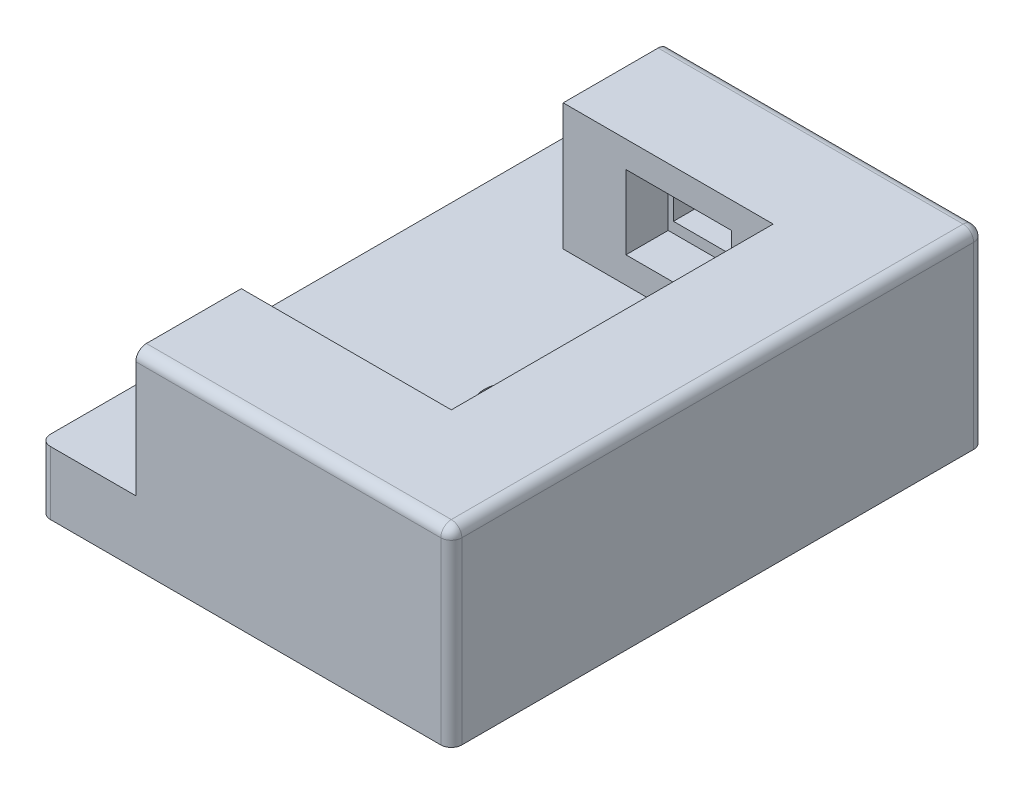
from build123d import *

# Parameters (mm, degrees)
SKETCH1_W           = 39
SKETCH1_H           = 50.5
BOSS_EXTRUDE1_DEPTH = 6
SKETCH2_W           = 19.9
SKETCH2_H           = 10
BOSS_EXTRUDE2_DEPTH = 12
FILLET1_R           = 1
SKETCH3_W           = 10
SKETCH3_H           = 7
CUT_EXTRUDE1_DEPTH  = 4
SKETCH4_W           = 9
SKETCH4_H           = 5
CUT_EXTRUDE2_DEPTH  = 30
SKETCH7_W           = 8.4
SKETCH7_H           = 42
CUT_EXTRUDE4_DEPTH  = 1
SKETCH6_R           = 2.625
CUT_EXTRUDE5_DEPTH  = 7
FILLET2_R           = 1
CUT_EXTRUDE6_START  = -0.2
CUT_EXTRUDE6_DEPTH  = 0.2


# Read off the part's stored shape, not the designer's step: Cut-Extrude6
with BuildPart() as part:
    # Sketch1 → Boss-Extrude1 (new body)
    with BuildSketch(Plane(origin=(0, 0, 0), x_dir=(1, 0, 0), z_dir=(0, 1, 0))):
        Rectangle(SKETCH1_W, SKETCH1_H)
    extrude(amount=BOSS_EXTRUDE1_DEPTH)

    # Sketch2 → Boss-Extrude2 (add)
    with BuildSketch(Plane(origin=(0, 6, 0), x_dir=(1, 0, 0), z_dir=(0, 1, 0))):
        with Locations((-0.45, 20.25)):
            Rectangle(SKETCH2_W, SKETCH2_H)
        Polygon((19.5, -25.25), (19.5, 25.25), (9.5, 25.25), (9.5, 15.25), (9.5, -15.25), (9.5, -25.25), align=None)
        with Locations((-0.45, -20.25)):
            Rectangle(SKETCH2_W, SKETCH2_H)
    extrude(amount=BOSS_EXTRUDE2_DEPTH)

    # Fillet1
    fillet1_edges = [part.edges().sort_by_distance(p)[0] for p in [
        (19.5, 9, 25.25),
        (-19.5, 3, 25.25),
        (-19.5, 3, -25.25),
        (19.5, 9, -25.25),
    ]]
    fillet(fillet1_edges, radius=FILLET1_R)

    # Sketch3 → Cut-Extrude1 (cut)
    with BuildSketch(Plane.XY.offset(-15.25)):
        with Locations((0.55, 12)):
            Rectangle(SKETCH3_W, SKETCH3_H)
    extrude(amount=-CUT_EXTRUDE1_DEPTH, mode=Mode.SUBTRACT)

    # Sketch4 → Cut-Extrude2 (cut)
    with BuildSketch(Plane.XY.offset(-19.25)):
        with Locations((0.55, 12)):
            Rectangle(SKETCH4_W, SKETCH4_H)
    extrude(amount=-CUT_EXTRUDE2_DEPTH, mode=Mode.SUBTRACT)

    # Sketch7 → Cut-Extrude4 (cut)
    with BuildSketch(Plane.XZ):
        Rectangle(SKETCH7_W, SKETCH7_H)
    extrude(amount=-CUT_EXTRUDE4_DEPTH, mode=Mode.SUBTRACT)

    # Sketch6 → Cut-Extrude5 (cut)
    with BuildSketch(Plane.XZ):
        with Locations(Location((0, 0, 0), (0, 0, 270))):
            Circle(SKETCH6_R)
    extrude(amount=-CUT_EXTRUDE5_DEPTH, mode=Mode.SUBTRACT)

    # Fillet2
    fillet2_edges = [part.edges().sort_by_distance(p)[0] for p in [
        (4.05, 18, 25.25),
        (4.05, 18, -25.25),
        (19.5, 18, 0),
        (19.207106781, 18, 24.957106781),
        (19.207106781, 18, -24.957106781),
    ]]
    fillet(fillet2_edges, radius=FILLET2_R)

    # Cut-Extrude6 outline → Cut-Extrude6 (cut)
    # profile 1 of 4: a face of its own
    with BuildSketch(Plane.XZ.offset(CUT_EXTRUDE6_START)):
        with BuildLine():
            add(Edge.make_bspline(
                [(-14.308131241, 13.125263447), (-14.308980223, 13.087665755), (-14.310639776, 13.014171423), (-14.322776413, 12.906989941), (-14.3431925, 12.805891458), (-14.372807449, 12.711212736), (-14.409568321, 12.622206203), (-14.455631717, 12.539891336), (-14.509298167, 12.463522469), (-14.571714418, 12.394314956), (-14.641685625, 12.331476542), (-14.720907067, 12.278367739), (-14.807094418, 12.23190008), (-14.901740923, 12.195472099), (-15.003772579, 12.165777911), (-15.113932246, 12.145562231), (-15.23201314, 12.133422526), (-15.31333151, 12.131803373), (-15.355206847, 12.130969581)],
                knots=[0, 0, 0, 0, 0.06856617, 0.134030168, 0.196454761, 0.256394301, 0.314703772, 0.371776203, 0.428085687, 0.484590203, 0.541418281, 0.599152462, 0.658128935, 0.719652317, 0.783746101, 0.851702059, 0.923633168, 1, 1, 1, 1], degree=3))
            Line((-14.308131241, 13.125263447), (-14.308131241, 14.716561592))
            add(Edge.make_bspline(
                [(-15.355206847, 15.710855458), (-15.313334474, 15.710012414), (-15.232021861, 15.708375294), (-15.113900457, 15.696362026), (-15.003946149, 15.675717663), (-14.901404463, 15.647543433), (-14.807491008, 15.609521297), (-14.720678738, 15.564382427), (-14.641729685, 15.510984245), (-14.571671344, 15.44826556), (-14.509555785, 15.379068609), (-14.455379108, 15.303295374), (-14.409812711, 15.221170885), (-14.372475701, 15.13240295), (-14.343358879, 15.037542429), (-14.322676053, 14.936043397), (-14.310661195, 14.828359853), (-14.3089874, 14.754395113), (-14.308131241, 14.716561592)],
                knots=[0, 0, 0, 0, 0.076339051, 0.148243993, 0.21617523, 0.280126803, 0.341788009, 0.400540276, 0.458253454, 0.51506086, 0.571544819, 0.627480508, 0.684532177, 0.742420914, 0.802752769, 0.865154654, 0.93102559, 1, 1, 1, 1], degree=3))
            add(Edge.make_bspline(
                [(-16.402282454, 14.716561592), (-16.401448605, 14.754396934), (-16.39982884, 14.827892681), (-16.387620655, 14.935084133), (-16.366999863, 15.036088667), (-16.338139551, 15.131165911), (-16.299701675, 15.219558417), (-16.254266201, 15.302223402), (-16.199546328, 15.378020873), (-16.137340879, 15.447841654), (-16.066654748, 15.509825261), (-15.987920562, 15.563962536), (-15.901436654, 15.609480922), (-15.806906712, 15.646713854), (-15.704901922, 15.675783478), (-15.595076234, 15.696318157), (-15.477684344, 15.708389052), (-15.396843045, 15.710017004), (-15.355206847, 15.710855458)],
                knots=[0, 0, 0, 0, 0.069033217, 0.13409811, 0.196553198, 0.256936492, 0.315044904, 0.372145214, 0.428733909, 0.485266027, 0.542447048, 0.599851484, 0.659239938, 0.720389911, 0.784931953, 0.852494788, 0.924029471, 1, 1, 1, 1], degree=3))
            Line((-16.402282454, 14.716561592), (-16.402282454, 13.125263447))
            add(Edge.make_bspline(
                [(-15.355206847, 12.130969581), (-15.397328177, 12.131718243), (-15.479161878, 12.133172749), (-15.597862737, 12.146487619), (-15.708748078, 12.166515181), (-15.811488176, 12.195891665), (-15.906166283, 12.233425072), (-15.992325917, 12.280269666), (-16.070920919, 12.334635976), (-16.14092636, 12.397623893), (-16.202461246, 12.468105157), (-16.256222287, 12.544526056), (-16.301182858, 12.627264944), (-16.338599174, 12.715302027), (-16.366972726, 12.809604906), (-16.387647839, 12.909583074), (-16.399766759, 13.015598683), (-16.401430903, 13.088142437), (-16.402282454, 13.125263447)],
                knots=[0, 0, 0, 0, 0.076847613, 0.149300238, 0.217724591, 0.282274918, 0.343996617, 0.40321491, 0.460873789, 0.518025922, 0.574601916, 0.631300913, 0.688198808, 0.746144339, 0.805578444, 0.867616589, 0.932258732, 1, 1, 1, 1], degree=3))
        make_face()
        with BuildLine():
            add(Edge.make_bspline(
                [(-15.742510699, 13.294307669), (-15.74156227, 13.255477766), (-15.739759695, 13.181678058), (-15.722424623, 13.077440427), (-15.695376759, 12.985698623), (-15.662189251, 12.918993234), (-15.629355074, 12.873561838), (-15.600512217, 12.845253799), (-15.568734946, 12.82031458), (-15.533080907, 12.800458121), (-15.493565344, 12.785501946), (-15.450884435, 12.773888819), (-15.404128407, 12.7676767), (-15.371866266, 12.766894286), (-15.355206847, 12.766490266)],
                knots=[0, 0, 0, 0, 0.155926433, 0.296352143, 0.423287338, 0.539086606, 0.5937399, 0.64778853, 0.700917261, 0.755670684, 0.811029318, 0.870359846, 0.933056839, 1, 1, 1, 1], degree=3))
            Line((-15.742510699, 13.294307669), (-15.742510699, 14.548230637))
            add(Edge.make_bspline(
                [(-15.355206847, 15.075334774), (-15.371625842, 15.074913893), (-15.403644829, 15.074093125), (-15.449966719, 15.068049978), (-15.492329926, 15.056174996), (-15.531692447, 15.041426162), (-15.567056223, 15.021412731), (-15.599315787, 14.997353895), (-15.627911821, 14.968940764), (-15.660621206, 14.923597003), (-15.694710158, 14.857692705), (-15.722789954, 14.766203477), (-15.739665852, 14.661548351), (-15.741530096, 14.587290621), (-15.742510699, 14.548230637)],
                knots=[0, 0, 0, 0, 0.066094141, 0.128891414, 0.187392687, 0.242839864, 0.297680862, 0.350314872, 0.404449949, 0.459190658, 0.574763819, 0.701273799, 0.842868334, 1, 1, 1, 1], degree=3))
            add(Edge.make_bspline(
                [(-14.967902996, 14.548230637), (-14.968857442, 14.587297968), (-14.97067196, 14.661569666), (-14.987869204, 14.766060885), (-15.014837572, 14.857787436), (-15.049009445, 14.923690875), (-15.081839538, 14.968641563), (-15.10970297, 14.997873772), (-15.142510753, 15.020903378), (-15.177546237, 15.041856439), (-15.217225174, 15.055966978), (-15.259713616, 15.068092992), (-15.30629749, 15.074113226), (-15.338551583, 15.074918796), (-15.355206847, 15.075334774)],
                knots=[0, 0, 0, 0, 0.157001963, 0.29847962, 0.424599144, 0.540076905, 0.594772429, 0.64819097, 0.701549572, 0.755513041, 0.811806692, 0.870259676, 0.933005114, 1, 1, 1, 1], degree=3))
            Line((-14.967902996, 14.548230637), (-14.967902996, 13.294307669))
            add(Edge.make_bspline(
                [(-15.355206847, 12.766490266), (-15.338551314, 12.76690588), (-15.306296697, 12.767710747), (-15.259716469, 12.773735886), (-15.217215423, 12.785844941), (-15.177580622, 12.800014871), (-15.142265922, 12.820829847), (-15.109928742, 12.844732822), (-15.081811222, 12.873854004), (-15.048871511, 12.919027297), (-15.014861355, 12.985507616), (-14.988052726, 13.077467086), (-14.97063528, 13.181670218), (-14.968844971, 13.255475063), (-14.967902996, 13.294307669)],
                knots=[0, 0, 0, 0, 0.066965806, 0.129684008, 0.18811162, 0.244380836, 0.298320881, 0.352227044, 0.405622398, 0.460294181, 0.576569474, 0.703547608, 0.844020821, 1, 1, 1, 1], degree=3))
        make_face(mode=Mode.SUBTRACT)
    # profile 2 of 4: a face of its own
    with BuildSketch(Plane.XZ.offset(CUT_EXTRUDE6_START)):
        with BuildLine():
            add(Edge.make_bspline(
                [(-10.969863682, 13.637187754), (-10.974424349, 13.635772404), (-11.001453239, 13.627747388), (-11.053175376, 13.616300174), (-11.126871123, 13.605679193), (-11.177800674, 13.604952471), (-11.203994294, 13.604578711)],
                knots=[0.562249978, 0.562249978, 0.562249978, 0.562249978, 0.588680393, 0.718309822, 0.855123691, 1, 1, 1, 1], degree=3))
            Line((-10.969863682, 13.637187754), (-11.613409415, 12.167346186))
            Line((-11.613409415, 12.167346186), (-10.915121255, 12.167346186))
            Line((-10.915121255, 12.167346186), (-10.289586305, 13.667346186))
            add(Edge.make_bspline(
                [(-10.043509272, 14.618130779), (-10.044297071, 14.581710538), (-10.045903645, 14.507437983), (-10.060597728, 14.39430138), (-10.082277388, 14.277179011), (-10.125669899, 14.115891751), (-10.192094006, 13.910756384), (-10.256778567, 13.74925766), (-10.289586305, 13.667346186)],
                knots=[0, 0, 0, 0, 0.110526352, 0.225398687, 0.345876726, 0.471934397, 0.732167343, 1, 1, 1, 1], degree=3))
            Line((-10.043509272, 14.618130779), (-10.043509272, 14.62027058))
            add(Edge.make_bspline(
                [(-11.067047076, 15.703722791), (-11.027537869, 15.703012745), (-10.950649563, 15.701630934), (-10.838954567, 15.687711948), (-10.733965872, 15.665542652), (-10.635356104, 15.635539652), (-10.544054141, 15.594882816), (-10.459135489, 15.546585056), (-10.381783952, 15.488041314), (-10.310971754, 15.421802069), (-10.247853178, 15.347068845), (-10.193035849, 15.264909778), (-10.146125661, 15.175607467), (-10.108395913, 15.078669583), (-10.079257086, 14.974221924), (-10.059056288, 14.86244918), (-10.04573849, 14.743747958), (-10.044265411, 14.662153446), (-10.043509272, 14.62027058)],
                knots=[0, 0, 0, 0, 0.069912603, 0.136055922, 0.198875098, 0.259711606, 0.318129836, 0.37545066, 0.432270191, 0.489439385, 0.546778748, 0.605028439, 0.663953901, 0.724995347, 0.788821619, 0.855604611, 0.925881133, 1, 1, 1, 1], degree=3))
            add(Edge.make_bspline(
                [(-12.092011412, 14.632396115), (-12.091265357, 14.673806784), (-12.089812319, 14.754459262), (-12.076365451, 14.87169912), (-12.056655886, 14.982031247), (-12.025909926, 15.084641232), (-11.988829082, 15.180686963), (-11.941581837, 15.26892612), (-11.887824577, 15.351146125), (-11.823703523, 15.424374106), (-11.753001399, 15.490492597), (-11.674990362, 15.547805282), (-11.589732005, 15.595748832), (-11.498377665, 15.635898418), (-11.400037519, 15.666632795), (-11.295026336, 15.68742507), (-11.183462277, 15.701710752), (-11.106562287, 15.703039838), (-11.067047076, 15.703722791)],
                knots=[0, 0, 0, 0, 0.073683481, 0.14350783, 0.209828743, 0.272905077, 0.333890888, 0.392768232, 0.450753559, 0.508363913, 0.565560837, 0.622782808, 0.680210996, 0.739340297, 0.800109859, 0.863190453, 0.929700145, 1, 1, 1, 1], degree=3))
            Line((-12.092011412, 14.632396115), (-12.092011412, 14.630256314))
            add(Edge.make_bspline(
                [(-11.203994294, 13.604578711), (-11.236387457, 13.60526876), (-11.299807793, 13.60661976), (-11.392363785, 13.621104596), (-11.480585129, 13.641843515), (-11.563997515, 13.672678658), (-11.641951902, 13.713322688), (-11.716203352, 13.760977295), (-11.784818084, 13.818602841), (-11.847974298, 13.884406781), (-11.906211558, 13.956537547), (-11.95468471, 14.036687215), (-11.99867827, 14.120869995), (-12.03195633, 14.21203544), (-12.060028529, 14.308109203), (-12.077336615, 14.410586835), (-12.090580036, 14.518405866), (-12.091527056, 14.592407791), (-12.092011412, 14.630256314)],
                knots=[0, 0, 0, 0, 0.063613697, 0.124544864, 0.183706845, 0.241517269, 0.29878119, 0.356199341, 0.41459417, 0.474409529, 0.53527436, 0.59634871, 0.658208168, 0.721651722, 0.786738137, 0.8546566, 0.925663648, 1, 1, 1, 1], degree=3))
        make_face()
        with BuildLine():
            add(Edge.make_bspline(
                [(-11.432952924, 14.64666145), (-11.43205653, 14.614466702), (-11.430354146, 14.553324167), (-11.412384167, 14.467521338), (-11.383371807, 14.392761559), (-11.341486727, 14.33040533), (-11.28851759, 14.280208987), (-11.223458188, 14.24556058), (-11.148454982, 14.224552076), (-11.095010313, 14.222115864), (-11.067047076, 14.220841193)],
                knots=[0, 0, 0, 0, 0.151114012, 0.28698762, 0.409825718, 0.52573438, 0.637211761, 0.749219897, 0.868787218, 1, 1, 1, 1], degree=3))
            Line((-11.432952924, 14.64666145), (-11.432952924, 14.649514517))
            add(Edge.make_bspline(
                [(-11.067047076, 15.063209239), (-11.094761761, 15.06217315), (-11.147672062, 15.060195145), (-11.222207028, 15.039840383), (-11.286832394, 15.005783529), (-11.340572668, 14.957708729), (-11.382471632, 14.896926683), (-11.412628481, 14.824633488), (-11.430291531, 14.740701721), (-11.432034353, 14.680987481), (-11.432952924, 14.649514517)],
                knots=[0, 0, 0, 0, 0.132102272, 0.252197376, 0.36547029, 0.478052562, 0.59301992, 0.715121671, 0.84985214, 1, 1, 1, 1], degree=3))
            add(Edge.make_bspline(
                [(-10.703281027, 14.651654317), (-10.704140133, 14.682909364), (-10.7057632, 14.741958026), (-10.72408142, 14.824852307), (-10.752846117, 14.897123308), (-10.795000562, 14.957440789), (-10.847884427, 15.00577871), (-10.912062596, 15.039983747), (-10.986430276, 15.060169981), (-11.039335204, 15.0621645), (-11.067047076, 15.063209239)],
                knots=[0, 0, 0, 0, 0.149859196, 0.283121796, 0.405474214, 0.521093228, 0.63346406, 0.746373123, 0.867148948, 1, 1, 1, 1], degree=3))
            Line((-10.703281027, 14.651654317), (-10.703281027, 14.649514517))
            add(Edge.make_bspline(
                [(-11.067047076, 14.220841193), (-11.039562347, 14.222123215), (-10.98705794, 14.224572277), (-10.913051185, 14.24555487), (-10.848959666, 14.281204926), (-10.796161517, 14.332037671), (-10.753593745, 14.394857557), (-10.723804333, 14.470031675), (-10.705911846, 14.556188404), (-10.704188473, 14.617323623), (-10.703281027, 14.649514517)],
                knots=[0, 0, 0, 0, 0.129120583, 0.246660598, 0.358349353, 0.470708246, 0.588290832, 0.712713462, 0.848728592, 1, 1, 1, 1], degree=3))
        make_face(mode=Mode.SUBTRACT)
    # profile 3 of 4: a face of its own
    with BuildSketch(Plane.XZ.offset(CUT_EXTRUDE6_START)):
        Polygon((-19.235378031, 13.310712805), (-19.235378031, 12.704436057), (-17.822396576, 12.704436057), (-17.822396576, 12.165206386), (-17.162624822, 12.165206386), (-17.162624822, 12.704436057), (-16.888017118, 12.704436057), (-16.888017118, 13.339956742), (-17.162624822, 13.339956742), (-17.162624822, 14.22583406), (-17.822396576, 14.22583406), (-17.822396576, 13.339956742), (-18.460057061, 13.339956742), (-17.410128388, 15.665206386), (-18.156918688, 15.665206386), align=None)
    # profile 4 of 4: a face of its own
    with BuildSketch(Plane.XZ.offset(CUT_EXTRUDE6_START)):
        Polygon((-12.72253923, 15.667346186), (-13.285306705, 15.667346186), (-13.808131241, 15.431968154), (-13.808131241, 14.730826928), (-13.381597718, 14.892738483), (-13.381597718, 12.167346186), (-12.72253923, 12.167346186), align=None)
    extrude(amount=CUT_EXTRUDE6_DEPTH, mode=Mode.SUBTRACT)


solid = part.part
